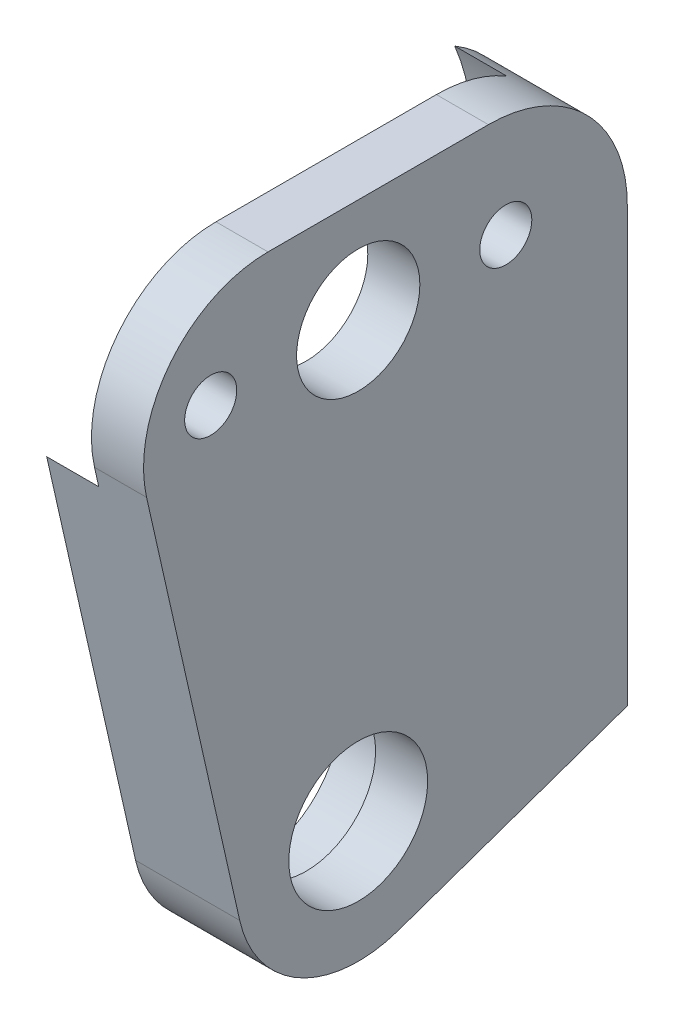
from build123d import *

# Parameters (mm, degrees)
SKETCH1_R           = 3.55
SKETCH1_R_2         = 1.5
SKETCH1_R_3         = 4
BOSS_EXTRUDE1_DEPTH = 6
SKETCH2_R           = 4.99
CUT_EXTRUDE1_DEPTH  = 3
SKETCH3_R           = 12.55
CUT_EXTRUDE2_DEPTH  = 3
SKETCH4_W           = 6
SKETCH4_H           = 12
CUT_EXTRUDE3_DEPTH  = 3


with BuildPart() as part:
    # Sketch1 → Boss-Extrude1 (new body)
    with BuildSketch(Plane(origin=(0, 0, 0), x_dir=(0, 0, -1), z_dir=(1, 0, 0))):
        with BuildLine():
            Line((29.150635095, 18.5), (16.453299712, 18.5))
            ThreePointArc((16.453299712, 18.5), (10.851686215, 15.806863319), (9.456886696, 9.75))
            Line((9.456886696, 9.75), (14.822135992, -14.04))
            ThreePointArc((14.822135992, -14.04), (18.255133365, -18.621320773), (23.959234314, -19.108356047))
            Line((23.959234314, -19.108356047), (37.150635095, -14.5))
            Line((37.150635095, -14.5), (37.150635095, 10.5))
            ThreePointArc((37.150635095, 10.5), (34.807489344, 16.156854249), (29.150635095, 18.5))
        make_face()
        with Locations((21.650635095, 12.5)):
            Circle(SKETCH1_R, mode=Mode.SUBTRACT)
        with Locations((30.150635095, 12.5)):
            Circle(SKETCH1_R_2, mode=Mode.SUBTRACT)
        with Locations((13.150635095, 12.5)):
            Circle(SKETCH1_R_2, mode=Mode.SUBTRACT)
        with Locations((21.650635095, -12.5)):
            Circle(SKETCH1_R_3, mode=Mode.SUBTRACT)
    extrude(amount=BOSS_EXTRUDE1_DEPTH)

    # Sketch2 → Cut-Extrude1 (cut)
    with BuildSketch(Plane(origin=(0, 0, 0), x_dir=(0, 0, -1), z_dir=(1, 0, 0))):
        with Locations((21.650635095, -12.5)):
            Circle(SKETCH2_R)
    extrude(amount=CUT_EXTRUDE1_DEPTH, mode=Mode.SUBTRACT)

    # Sketch3 → Cut-Extrude2 (cut)
    with BuildSketch(Plane(origin=(0, 0, 0), x_dir=(0, 0, -1), z_dir=(1, 0, 0))):
        with Locations((21.650635095, 12.5)):
            Circle(SKETCH3_R)
    extrude(amount=CUT_EXTRUDE2_DEPTH, mode=Mode.SUBTRACT)

    # Sketch4 → Cut-Extrude3 (cut)
    with BuildSketch(Plane.ZY):
        with Locations((-34.150635095, -6.5)):
            Rectangle(SKETCH4_W, SKETCH4_H)
    extrude(amount=-CUT_EXTRUDE3_DEPTH, mode=Mode.SUBTRACT)


solid = part.part
